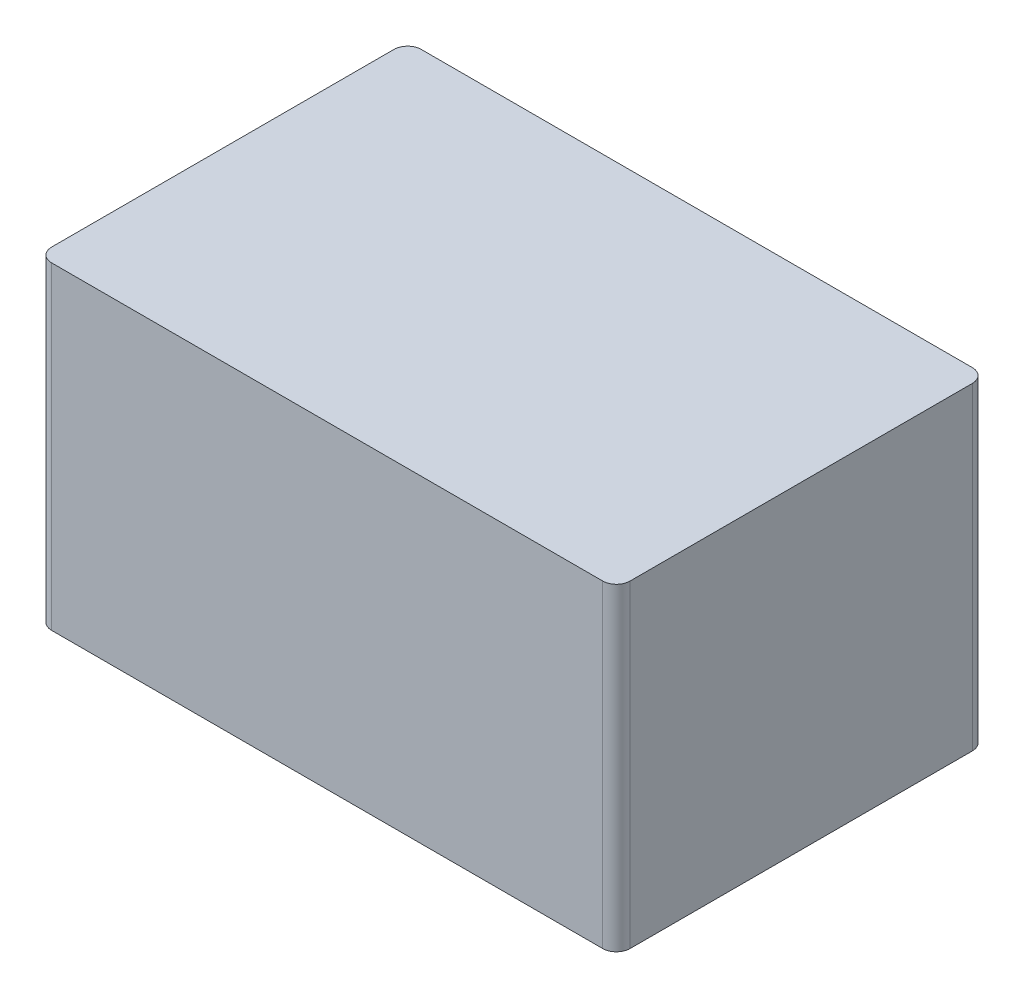
from build123d import *

# Parameters (mm, degrees)
SKETCH1_W           = 84.5
SKETCH1_H           = 54
BOSS_EXTRUDE2_DEPTH = 46.5
FILLET1_R           = 2


with BuildPart() as part:
    # Sketch1 → Boss-Extrude2 (new body)
    with BuildSketch(Plane(origin=(0, 0, 0), x_dir=(1, 0, 0), z_dir=(0, 1, 0))):
        with Locations((42.25, 27)):
            Rectangle(SKETCH1_W, SKETCH1_H)
    extrude(amount=BOSS_EXTRUDE2_DEPTH)

    # Fillet1
    fillet1_edges = [part.edges().sort_by_distance(p)[0] for p in [
        (0, 23.25, -54),
        (0, 23.25, 0),
        (84.5, 23.25, -54),
        (84.5, 23.25, 0),
    ]]
    fillet(fillet1_edges, radius=FILLET1_R)


solid = part.part
